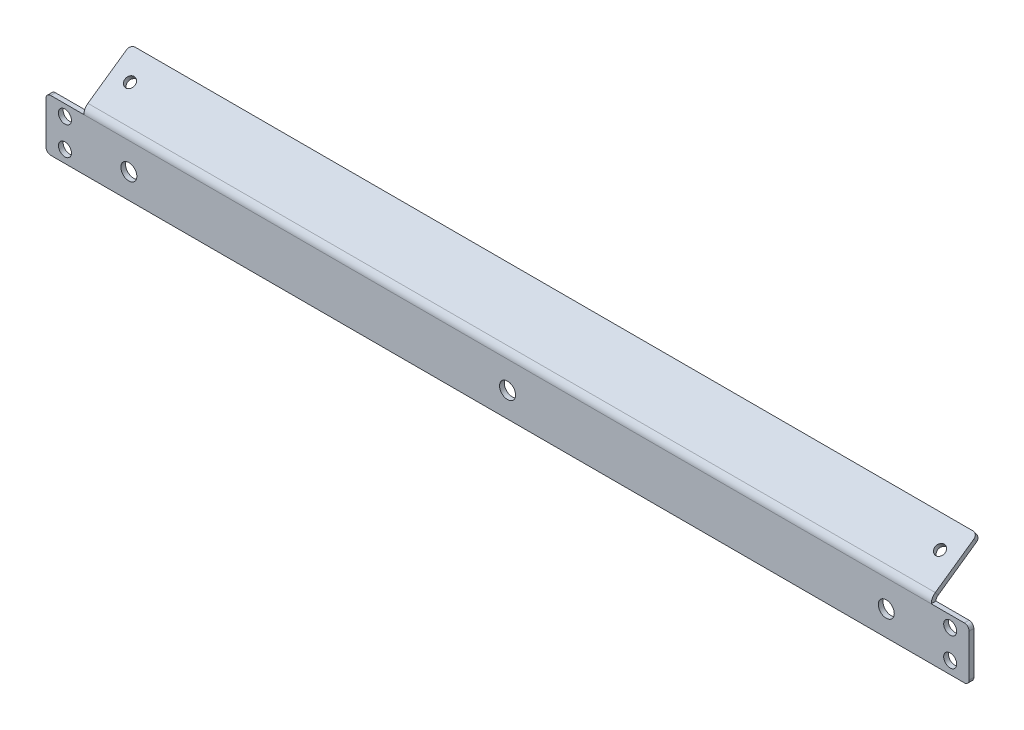
from build123d import *

# Parameters (mm, degrees)
BASE_FLANGE1_DEPTH = 638.175
SKETCH6_R          = 4.3688
SKETCH6_R_2        = 5.3578125
SKETCH6_W          = 25.4
SKETCH6_H          = 25.158862996
CUT_EXTRUDE1_DEPTH = 642.835460144
SKETCH8_R          = 3.429
CUT_EXTRUDE2_DEPTH = 3.175
FILLET1_R          = 3.175


# Sheet-metal steps are written as plain solids
with BuildPart() as part:
    # Sketch1 → Base-Flange1 (new body)
    with BuildSketch(Plane(origin=(0, 0, 0), x_dir=(0, 0, -1), z_dir=(1, 0, 0))):
        with BuildLine():
            Line((0, 0), (0, 34.794399229))
            ThreePointArc((0, 34.794399229), (0.717481209, 37.726502923), (2.707789629, 39.99601471))
            Line((2.707789629, 39.99601471), (31.209692887, 59.953262225))
            Line((31.209692887, 59.953262225), (33.030798073, 57.352454484))
            Line((33.030798073, 57.352454484), (4.528894815, 37.39520697))
            ThreePointArc((4.528894815, 37.39520697), (3.533740605, 36.260451076), (3.175, 34.794399229))
            Line((3.175, 34.794399229), (3.175, 0))
            Line((3.175, 0), (0, 0))
        make_face()
    extrude(amount=BASE_FLANGE1_DEPTH)

    # Sketch6 → Cut-Extrude1 (cut, through all)
    with BuildSketch(Plane.XY):
        with Locations((31.75, 27.305)):
            Circle(SKETCH6_R)
        with Locations((31.75, 8.255)):
            Circle(SKETCH6_R)
        with Locations((625.475, 27.305)):
            Circle(SKETCH6_R)
        with Locations((625.475, 8.255)):
            Circle(SKETCH6_R)
        with Locations((74.6125, 16.69209113)):
            Circle(SKETCH6_R_2)
        with Locations((328.6125, 16.69209113)):
            Circle(SKETCH6_R_2)
        with Locations((582.6125, 16.69209113)):
            Circle(SKETCH6_R_2)
        Polygon((19.05, 34.794399229), (44.45, 34.794399229), (44.45, 59.953262225), (0, 59.953262225), (0, 0), (19.05, 0), align=None)
        with Locations((625.475, 47.373830727)):
            Rectangle(SKETCH6_W, SKETCH6_H)
    extrude(amount=-CUT_EXTRUDE1_DEPTH, mode=Mode.SUBTRACT)

    # Sketch8 → Cut-Extrude2 (cut)
    with BuildSketch(Plane(origin=(0, 25.56548373, 17.901144426), x_dir=(1, 0, 0), z_dir=(0, 0.8191520442889929, 0.5735764363510447))):
        with Locations(Location((57.15, 44.078262225, 0), (0, 0, 270))):
            Circle(SKETCH8_R)
        with Locations(Location((600.456, 44.078262225, 0), (0, 0, 270))):
            Circle(SKETCH8_R)
    extrude(amount=-CUT_EXTRUDE2_DEPTH, mode=Mode.SUBTRACT)

    # Fillet1
    fillet1_edges = [part.edges().sort_by_distance(p)[0] for p in [
        (638.175, 34.794399229, -1.5875),
        (638.175, 0, -1.5875),
        (612.775, 58.652858355, -32.12024548),
        (19.05, 0, -1.5875),
        (44.45, 58.652858355, -32.12024548),
        (19.05, 34.794399229, -1.5875),
    ]]
    fillet(fillet1_edges, radius=FILLET1_R)


solid = part.part
